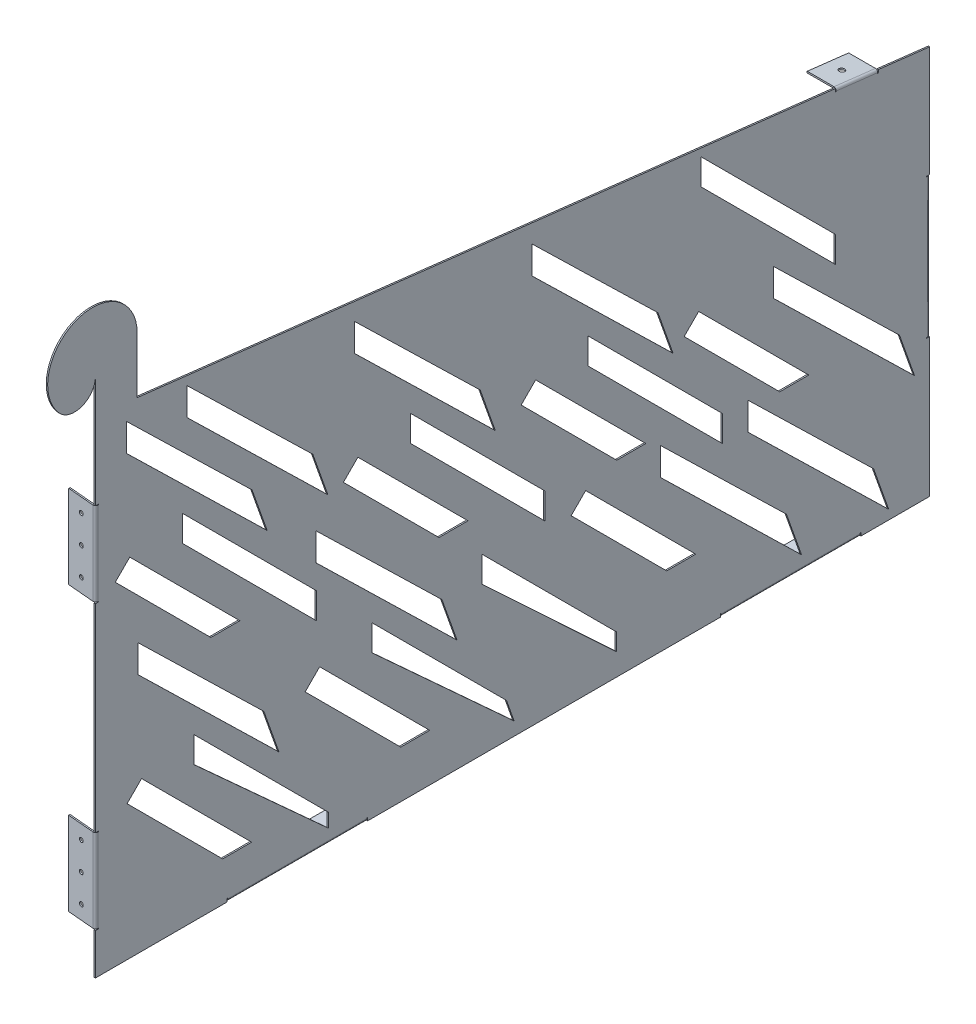
from build123d import *

# Parameters (mm, degrees)
BASE_FLANGE1_DEPTH            = 1
EDGE_FLANGE1_STRIP_W          = 5.4732
EDGE_FLANGE1_STRIP_H          = 1
EDGE_FLANGE1_STRIP_CUT_DEPTH  = 100
EDGE_FLANGE1_RELIEF_W         = 5.9732
EDGE_FLANGE1_RELIEF_H         = 0.5
EDGE_FLANGE1_RELIEF_CUT_DEPTH = 1
EDGE_FLANGE1_DEPTH            = 100
EDGE_FLANGE1_PROFILE_W        = 100
EDGE_FLANGE1_PROFILE_H        = 19.2634
EDGE_FLANGE1_PROFILE_R        = 1.5
EDGE_FLANGE1_FLAT_DEPTH       = 1
EDGE_FLANGE2_START            = -132.311951656
EDGE_FLANGE2_DEPTH            = 61
EDGE_FLANGE2_2_DEPTH          = 0.5
EDGE_FLANGE2_START_2          = -71.811951656
EDGE_FLANGE2_3_DEPTH          = 0.5
EDGE_FLANGE2_START_3          = -131.811951656
EDGE_FLANGE2_4_DEPTH          = 60
EDGE_FLANGE2_START_4          = -321.467617465
EDGE_FLANGE2_5_OUTLINE_R      = 1.5
EDGE_FLANGE2_5_DEPTH          = 1.000000001
CUT_EXTRUDE1_DEPTH            = 10
EDGE_FLANGE3_STRIP_W          = 5.4732
EDGE_FLANGE3_STRIP_H          = 1
EDGE_FLANGE3_STRIP_CUT_DEPTH  = 30
EDGE_FLANGE3_RELIEF_W         = 5.9732
EDGE_FLANGE3_RELIEF_H         = 0.5
EDGE_FLANGE3_RELIEF_CUT_DEPTH = 1
EDGE_FLANGE3_DEPTH            = 30
EDGE_FLANGE3_PROFILE_W        = 30
EDGE_FLANGE3_PROFILE_H        = 19.2634
EDGE_FLANGE3_PROFILE_R        = 2
EDGE_FLANGE3_FLAT_DEPTH       = 1
EDGE_FLANGE4_START            = -62.311951656
EDGE_FLANGE4_DEPTH            = 101
EDGE_FLANGE4_2_DEPTH          = 0.5
EDGE_FLANGE4_START_2          = 38.188048344
EDGE_FLANGE4_3_DEPTH          = 0.5
EDGE_FLANGE4_START_3          = -61.811951656
EDGE_FLANGE4_4_DEPTH          = 100
EDGE_FLANGE4_START_4          = 274.467223567
EDGE_FLANGE4_5_OUTLINE_R      = 1.5
EDGE_FLANGE4_5_DEPTH          = 1


with BuildPart() as part:
    # Base-Flange1: sheet metal written as solids
    # Sketch1 → Base-Flange1 (new body)
    with BuildSketch(Plane(origin=(0, 0, 0), x_dir=(0, 0, -1), z_dir=(1, 0, 0))):
        with BuildLine():
            Line((-292.608082875, 184.688048344), (277.391917125, 118.188048344))
            Line((277.391917125, 118.188048344), (277.391917125, -161.811951656))
            Line((277.391917125, -161.811951656), (-322.608082875, -161.811951656))
            Line((-322.608082875, -161.811951656), (-322.608082875, 188.188048344))
            Line((-322.608082875, 188.188048344), (-322.608082875, 213.188048344))
            ThreePointArc((-322.608082875, 213.188048344), (-332.239042701, 199.181856584), (-348.764537222, 203.161407511))
            ThreePointArc((-348.764537222, 203.161407511), (-336.339280516, 254.75856393), (-292.608082875, 224.688048344))
            Line((-292.608082875, 224.688048344), (-292.608082875, 184.688048344))
        make_face()
    extrude(amount=-BASE_FLANGE1_DEPTH)

    # Edge-Flange1: sheet metal written as solids
    # Edge-Flange1 strip (on a plane across the edge) → Edge-Flange1 strip cut (cut)
    with BuildSketch(Plane(origin=(-1, -161.811951656, -227.391917125), x_dir=(0, 1, 0), z_dir=(0, 0, 1))):
        with Locations((-1, -0.5)):
            Rectangle(EDGE_FLANGE1_STRIP_W, EDGE_FLANGE1_STRIP_H)
    edge_flange1_strip_cut = extrude(amount=EDGE_FLANGE1_STRIP_CUT_DEPTH, mode=Mode.SUBTRACT)

    # Edge-Flange1 relief (on the sheet) → Edge-Flange1 relief cut (cut)
    with BuildSketch(Plane(origin=(-1, -160.075351656, -227.391917125), x_dir=(0, 1, 0), z_dir=(-1, 0, 0))):
        with Locations((-2.4866, 0.25)):
            Rectangle(EDGE_FLANGE1_RELIEF_W, EDGE_FLANGE1_RELIEF_H)
        with Locations((-2.4866, -100.25)):
            Rectangle(EDGE_FLANGE1_RELIEF_W, EDGE_FLANGE1_RELIEF_H)
    edge_flange1_relief_cut = extrude(amount=-EDGE_FLANGE1_RELIEF_CUT_DEPTH, mode=Mode.SUBTRACT)

    # Edge-Flange1 bend section (on a plane across the edge) → Edge-Flange1 (add)
    with BuildSketch(Plane(origin=(-1, -161.811951656, -227.391917125), x_dir=(0, 1, 0), z_dir=(0, 0, 1))):
        with BuildLine():
            Line((0, 0.7366), (1, 0.7366))
            ThreePointArc((1, 0.7366), (1.215745145, 0.215745145), (1.7366, 0))
            Line((1.7366, 0), (1.7366, -1))
            ThreePointArc((1.7366, -1), (0.508638364, -0.491361636), (0, 0.7366))
        make_face()
    edge_flange1 = extrude(amount=EDGE_FLANGE1_DEPTH)

    # Edge-Flange1 profile (on flange) → Edge-Flange1 flat (add)
    with BuildSketch(Plane(origin=(-1, -161.811951656, 0), x_dir=(0, 0, -1), z_dir=(0, 1, 0))):
        with Locations((177.391917125, 10.3683)):
            Rectangle(EDGE_FLANGE1_PROFILE_W, EDGE_FLANGE1_PROFILE_H)
        with Locations((142.391917125, 10)):
            Circle(EDGE_FLANGE1_PROFILE_R, mode=Mode.SUBTRACT)
        with Locations((212.391917125, 10)):
            Circle(EDGE_FLANGE1_PROFILE_R, mode=Mode.SUBTRACT)
        with Locations((177.391917125, 10)):
            Circle(EDGE_FLANGE1_PROFILE_R, mode=Mode.SUBTRACT)
    edge_flange1_flat = extrude(amount=EDGE_FLANGE1_FLAT_DEPTH)

    # Mirror1: Edge-Flange1 strip cut, Edge-Flange1 relief cut, Edge-Flange1, Edge-Flange1 flat across plane
    add(edge_flange1_strip_cut.mirror(Plane.XY), mode=Mode.SUBTRACT)
    add(edge_flange1_relief_cut.mirror(Plane.XY), mode=Mode.SUBTRACT)
    add(edge_flange1.mirror(Plane.XY))
    add(edge_flange1_flat.mirror(Plane.XY))

    # Edge-Flange2: read off the stored shape, not the designer's step
    # Edge-Flange2 outline → Edge-Flange2 (cut)
    with BuildSketch(Plane(origin=(0, 0, 0), x_dir=(1, 0, 0), z_dir=(0, 1, 0)).offset(EDGE_FLANGE2_START)):
        with BuildLine():
            Line((0, -322.608082875), (0, -320.800405196))
            ThreePointArc((0, -320.800405196), (-0.271171885, -321.73223136), (-1, -322.373046287))
            Line((-1, -322.373046287), (-1, -322.608082875))
            Line((-1, -322.608082875), (0, -322.608082875))
        make_face()
    edge_flange2 = extrude(amount=EDGE_FLANGE2_DEPTH, mode=Mode.SUBTRACT)

    # Edge-Flange2 2 outline → Edge-Flange2 2 (cut)
    with BuildSketch(Plane(origin=(0, 0, 0), x_dir=(1, 0, 0), z_dir=(0, 1, 0)).offset(EDGE_FLANGE2_START)):
        with BuildLine():
            Line((0, -320.300405196), (-1, -320.300405196))
            Line((-1, -320.300405196), (-1, -322.373046287))
            ThreePointArc((-1, -322.373046287), (-0.271171885, -321.73223136), (0, -320.800405196))
            Line((0, -320.800405196), (0, -320.300405196))
        make_face()
    edge_flange2_2 = extrude(amount=EDGE_FLANGE2_2_DEPTH, mode=Mode.SUBTRACT)

    # Edge-Flange2 3 outline → Edge-Flange2 3 (cut)
    with BuildSketch(Plane(origin=(0, 0, 0), x_dir=(1, 0, 0), z_dir=(0, 1, 0)).offset(EDGE_FLANGE2_START_2)):
        with BuildLine():
            Line((0, -320.300405196), (-1, -320.300405196))
            Line((-1, -320.300405196), (-1, -322.373046287))
            ThreePointArc((-1, -322.373046287), (-0.271171885, -321.73223136), (0, -320.800405196))
            Line((0, -320.800405196), (0, -320.300405196))
        make_face()
    edge_flange2_3 = extrude(amount=EDGE_FLANGE2_3_DEPTH, mode=Mode.SUBTRACT)

    # Edge-Flange2 4 outline → Edge-Flange2 4 (add)
    with BuildSketch(Plane(origin=(0, 0, 0), x_dir=(1, 0, 0), z_dir=(0, 1, 0)).offset(EDGE_FLANGE2_START_3)):
        with BuildLine():
            Line((-1, -322.373046287), (-1, -320.800405196))
            ThreePointArc((-1, -320.800405196), (-1.238960253, -321.343483682), (-1.80079892, -321.53420221))
            Line((-1.80079892, -321.53420221), (-20.923893962, -319.861148183))
            Line((-20.923893962, -319.861148183), (-21.011049705, -320.857342881))
            Line((-21.011049705, -320.857342881), (-1.887954663, -322.530396908))
            ThreePointArc((-1.887954663, -322.530396908), (-1.433585428, -322.510364765), (-1, -322.373046287))
        make_face()
    edge_flange2_4 = extrude(amount=EDGE_FLANGE2_4_DEPTH)

    # Edge-Flange2 5 outline → Edge-Flange2 5 (cut)
    with BuildSketch(Plane(origin=(0, 0, 0), x_dir=(0.9961946980917458, 0, 0.0871557427476548), z_dir=(0.0871557427476548, 0, -0.9961946980917459)).offset(EDGE_FLANGE2_START_4)):
        with Locations((17.033463718, 121.811951656)):
            Circle(EDGE_FLANGE2_5_OUTLINE_R)
        with Locations((17.033463718, 101.811951656)):
            Circle(EDGE_FLANGE2_5_OUTLINE_R)
        with Locations((17.033463718, 81.811951656)):
            Circle(EDGE_FLANGE2_5_OUTLINE_R)
    edge_flange2_5 = extrude(amount=EDGE_FLANGE2_5_DEPTH, mode=Mode.SUBTRACT)

    # Mirror2: Edge-Flange2, Edge-Flange2 2, Edge-Flange2 3, Edge-Flange2 4, Edge-Flange2 5 across plane
    add(edge_flange2.mirror(Plane.ZX), mode=Mode.SUBTRACT)
    add(edge_flange2_2.mirror(Plane.ZX), mode=Mode.SUBTRACT)
    add(edge_flange2_3.mirror(Plane.ZX), mode=Mode.SUBTRACT)
    add(edge_flange2_4.mirror(Plane.ZX))
    add(edge_flange2_5.mirror(Plane.ZX), mode=Mode.SUBTRACT)

    # Sketch12 → Cut-Extrude1 (cut)
    with BuildSketch(Plane(origin=(0, 0, 0), x_dir=(0, 0, -1), z_dir=(1, 0, 0))):
        Polygon((83.881498856, -33.449819349), (174.342704111, -121.420431977), (185.213154513, -152.135664153), (83.881498856, -53.388999712), align=None)
        Polygon((-44.580106557, -36.904606479), (52.054055129, -133.538768165), (52.054055129, -145.866147521), (-44.580106557, -55.633624841), align=None)
        Polygon((29.921378653, -34.478937477), (109.107705591, -113.665264414), (88.243560484, -113.665264414), (19.4893061, -44.91101003), align=None)
        Polygon((-8.549939292, 138.296703352), (81.911265962, 50.326090724), (92.781716365, 19.610858548), (-8.549939292, 118.357522989), align=None)
        Polygon((31.714294744, 60.920031966), (128.34845643, -35.71412972), (128.34845643, -54.443148082), (31.714294744, 42.191013604), align=None)
        Polygon((-6.033424665, 52.424839755), (73.152902272, -26.761487182), (52.288757165, -26.761487182), (-16.465497218, 41.992767202), align=None)
        Polygon((-163.902775614, 37.300582979), (-73.441570359, -50.670029649), (-62.571119957, -81.385261826), (-163.902775614, 17.361402616), align=None)
        Polygon((-123.638541578, -40.076088407), (-27.004379892, -136.710250093), (-21.535031946, -152.267786527), (-123.638541578, -58.805106769), align=None)
        Polygon((-161.386260987, -48.571280618), (-82.19993405, -127.757607555), (-103.064079156, -127.757607555), (-171.81833354, -59.003353172), align=None)
        Polygon((-136.388882356, 154.066861683), (-45.927677102, 66.096249055), (-35.057226699, 35.381016878), (-136.388882356, 134.12768132), align=None)
        Polygon((-96.12464832, 76.690190297), (0.509513366, -19.943971389), (0.509513366, -38.672989751), (-96.12464832, 57.961171935), align=None)
        Polygon((-133.872367729, 68.194998086), (-54.686040792, -10.991328851), (-75.550185899, -10.991328851), (-144.304440282, 57.762925532), align=None)
        Polygon((-300.465636052, 173.863443417), (-210.004430798, 85.892830789), (-199.133980395, 55.177598613), (-300.465636052, 153.924263054), align=None)
        Polygon((-260.201402016, 96.486772031), (-163.56724033, -0.147389655), (-163.56724033, -18.876408017), (-260.201402016, 77.757753669), align=None)
        Polygon((-297.949121425, 87.99157982), (-218.762794488, 8.805252883), (-239.626939595, 8.805252883), (-308.381193978, 77.559507267), align=None)
        Polygon((-291.975122926, 31.699587994), (-201.513917672, -56.271024634), (-190.64346727, -86.98625681), (-291.975122926, 11.760407631), align=None)
        Polygon((-251.710888891, -45.677083392), (-155.076727205, -142.311245078), (-155.076727205, -152.267786527), (-251.710888891, -64.406101754), align=None)
        Polygon((-289.458608299, -54.172275603), (-210.272281362, -133.35860254), (-231.136426469, -133.35860254), (-299.890680853, -64.604348156), align=None)
        Polygon((165.156498308, 37.474871914), (255.617703563, -50.495740714), (266.488153965, -81.210972891), (165.156498308, 17.535691551), align=None)
        Polygon((111.196378106, 36.445753786), (190.382705043, -42.740573152), (169.518559936, -42.740573152), (100.764305552, 26.013681232), align=None)
        Polygon((112.989294196, 131.844723229), (209.623455882, 35.210561543), (209.623455882, 16.481543181), (112.989294196, 113.115704867), align=None)
        Polygon((146.547729139, -36.45763218), (237.008934394, -124.428244808), (247.879384796, -155.143476984), (146.547729139, -56.396812543), align=None)
        Polygon((-256.782869716, 174.26011882), (-166.321664461, 86.289506192), (-155.451214059, 55.574274016), (-256.782869716, 154.320938457), align=None)
    extrude(amount=-CUT_EXTRUDE1_DEPTH, mode=Mode.SUBTRACT)

    # Edge-Flange3: sheet metal written as solids
    # Edge-Flange3 strip (on a plane across the edge) → Edge-Flange3 strip cut (cut)
    with BuildSketch(Plane(origin=(-1, 126.016184071, -210.29361089), x_dir=(-3.4914813388431334e-15, -0.993263139087243, 0.11588069956017823), z_dir=(0, -0.11588069956017823, -0.993263139087243))):
        with Locations((-1, -0.5)):
            Rectangle(EDGE_FLANGE3_STRIP_W, EDGE_FLANGE3_STRIP_H)
    extrude(amount=EDGE_FLANGE3_STRIP_CUT_DEPTH, mode=Mode.SUBTRACT)

    # Edge-Flange3 relief (on the sheet) → Edge-Flange3 relief cut (cut)
    with BuildSketch(Plane(origin=(-1, 124.291283304, -210.092372467), x_dir=(-6.982962677686267e-15, -0.993263139087243, 0.11588069956017823), z_dir=(-1, 0, 0))):
        with Locations((-2.4866, 0.25)):
            Rectangle(EDGE_FLANGE3_RELIEF_W, EDGE_FLANGE3_RELIEF_H)
        with Locations((-2.4866, -30.25)):
            Rectangle(EDGE_FLANGE3_RELIEF_W, EDGE_FLANGE3_RELIEF_H)
    extrude(amount=-EDGE_FLANGE3_RELIEF_CUT_DEPTH, mode=Mode.SUBTRACT)

    # Edge-Flange3 bend section (on a plane across the edge) → Edge-Flange3 (add)
    with BuildSketch(Plane(origin=(-1, 126.016184071, -210.29361089), x_dir=(-3.4914813388431334e-15, -0.993263139087243, 0.11588069956017823), z_dir=(0, -0.11588069956017823, -0.993263139087243))):
        with BuildLine():
            Line((0, 0.7366), (1, 0.7366))
            ThreePointArc((1, 0.7366), (1.215745145, 0.215745145), (1.7366, 0))
            Line((1.7366, 0), (1.7366, -1))
            ThreePointArc((1.7366, -1), (0.508638364, -0.491361636), (0, 0.7366))
        make_face()
    extrude(amount=EDGE_FLANGE3_DEPTH)

    # Edge-Flange3 profile (on flange) → Edge-Flange3 flat (add)
    with BuildSketch(Plane(origin=(-1, 148.52879672, -17.328359617), x_dir=(0, 0.11588069956017823, 0.993263139087243), z_dir=(-3.4914813388431334e-15, -0.993263139087243, 0.11588069956017823))):
        with Locations((-209.274048516, 10.3683)):
            Rectangle(EDGE_FLANGE3_PROFILE_W, EDGE_FLANGE3_PROFILE_H)
        with Locations((-209.274048516, 10)):
            Circle(EDGE_FLANGE3_PROFILE_R, mode=Mode.SUBTRACT)
    extrude(amount=EDGE_FLANGE3_FLAT_DEPTH)

    # Edge-Flange4: read off the stored shape, not the designer's step
    # Edge-Flange4 outline → Edge-Flange4 (cut)
    with BuildSketch(Plane(origin=(0, 0, 0), x_dir=(1, 0, 0), z_dir=(0, 1, 0)).offset(EDGE_FLANGE4_START)):
        with BuildLine():
            ThreePointArc((-1, 277.301124595), (-0.271171885, 276.660309668), (0, 275.728483504))
            Line((0, 275.728483504), (0, 277.391917125))
            Line((0, 277.391917125), (-1, 277.391917125))
            Line((-1, 277.391917125), (-1, 277.301124595))
        make_face()
    extrude(amount=EDGE_FLANGE4_DEPTH, mode=Mode.SUBTRACT)

    # Edge-Flange4 2 outline → Edge-Flange4 2 (cut)
    with BuildSketch(Plane(origin=(0, 0, 0), x_dir=(1, 0, 0), z_dir=(0, 1, 0)).offset(EDGE_FLANGE4_START)):
        with BuildLine():
            Line((-1, 275.228483504), (0, 275.228483504))
            Line((0, 275.228483504), (0, 275.728483504))
            ThreePointArc((0, 275.728483504), (-0.271171885, 276.660309668), (-1, 277.301124595))
            Line((-1, 277.301124595), (-1, 275.228483504))
        make_face()
    extrude(amount=EDGE_FLANGE4_2_DEPTH, mode=Mode.SUBTRACT)

    # Edge-Flange4 3 outline → Edge-Flange4 3 (cut)
    with BuildSketch(Plane(origin=(0, 0, 0), x_dir=(1, 0, 0), z_dir=(0, 1, 0)).offset(EDGE_FLANGE4_START_2)):
        with BuildLine():
            Line((-1, 275.228483504), (0, 275.228483504))
            Line((0, 275.228483504), (0, 275.728483504))
            ThreePointArc((0, 275.728483504), (-0.271171885, 276.660309668), (-1, 277.301124595))
            Line((-1, 277.301124595), (-1, 275.228483504))
        make_face()
    extrude(amount=EDGE_FLANGE4_3_DEPTH, mode=Mode.SUBTRACT)

    # Edge-Flange4 4 outline → Edge-Flange4 4 (add)
    with BuildSketch(Plane(origin=(0, 0, 0), x_dir=(1, 0, 0), z_dir=(0, 1, 0)).offset(EDGE_FLANGE4_START_3)):
        with BuildLine():
            ThreePointArc((-1.652575872, 276.460275487), (-1.186840174, 276.218732108), (-1, 275.728483504))
            Line((-1, 275.728483504), (-1, 277.301124595))
            ThreePointArc((-1, 277.301124595), (-1.26306344, 277.399274541), (-1.538505646, 277.453748176))
            Line((-1.538505646, 277.453748176), (-20.755383553, 279.660224128))
            Line((-20.755383553, 279.660224128), (-20.869453778, 278.66675144))
            Line((-20.869453778, 278.66675144), (-1.652575872, 276.460275487))
        make_face()
    extrude(amount=EDGE_FLANGE4_4_DEPTH)

    # Edge-Flange4 5 outline → Edge-Flange4 5 (cut)
    with BuildSketch(Plane(origin=(0, 0, 0), x_dir=(0.9934726889248264, 0, 0.11407022556511005), z_dir=(0.11407022556511005, 0, -0.9934726889248264)).offset(EDGE_FLANGE4_START_4)):
        with Locations((-42.520811556, 41.811951656)):
            Circle(EDGE_FLANGE4_5_OUTLINE_R)
        with Locations((-42.520811556, 11.811951656)):
            Circle(EDGE_FLANGE4_5_OUTLINE_R)
        with Locations((-42.520811556, -18.188048344)):
            Circle(EDGE_FLANGE4_5_OUTLINE_R)
    extrude(amount=EDGE_FLANGE4_5_DEPTH, mode=Mode.SUBTRACT)


solid = part.part
